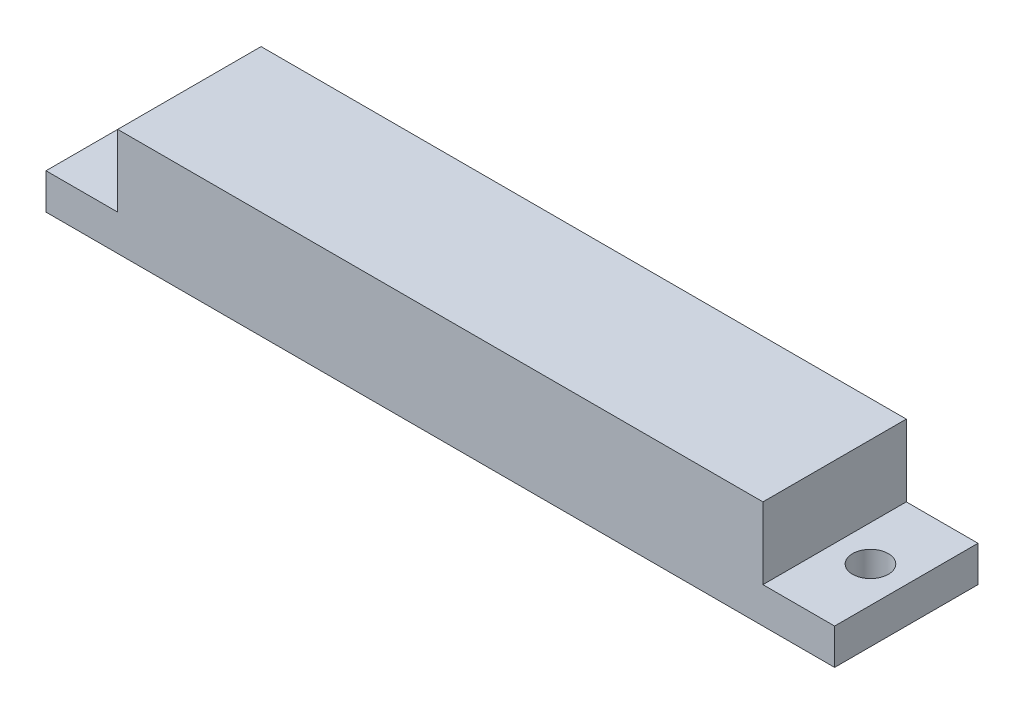
from build123d import *

# Parameters (mm, degrees)
BOSS_EXTRUDE1_DEPTH = 6.35
SKETCH6_R           = 1.5875
CUT_EXTRUDE1_DEPTH  = 37.061067996


with BuildPart() as part:
    # Sketch2 → Boss-Extrude1 (new, symmetric)
    with BuildSketch(Plane.XY):
        Polygon((-34.925, 1.5875), (-28.575, 1.5875), (-28.575, 7.9375), (28.575, 7.9375), (28.575, 1.5875), (34.925, 1.5875), (34.925, -1.5875), (-34.925, -1.5875), align=None)
    extrude(amount=BOSS_EXTRUDE1_DEPTH, both=True)

    # Sketch6 → Cut-Extrude1 (cut, through all)
    with BuildSketch(Plane(origin=(0, 1.5875, 0), x_dir=(1, 0, 0), z_dir=(0, 1, 0))):
        with Locations((-31.75, 0)):
            Circle(SKETCH6_R)
        with Locations((31.75, 0)):
            Circle(SKETCH6_R)
    extrude(amount=-CUT_EXTRUDE1_DEPTH, mode=Mode.SUBTRACT)


solid = part.part
